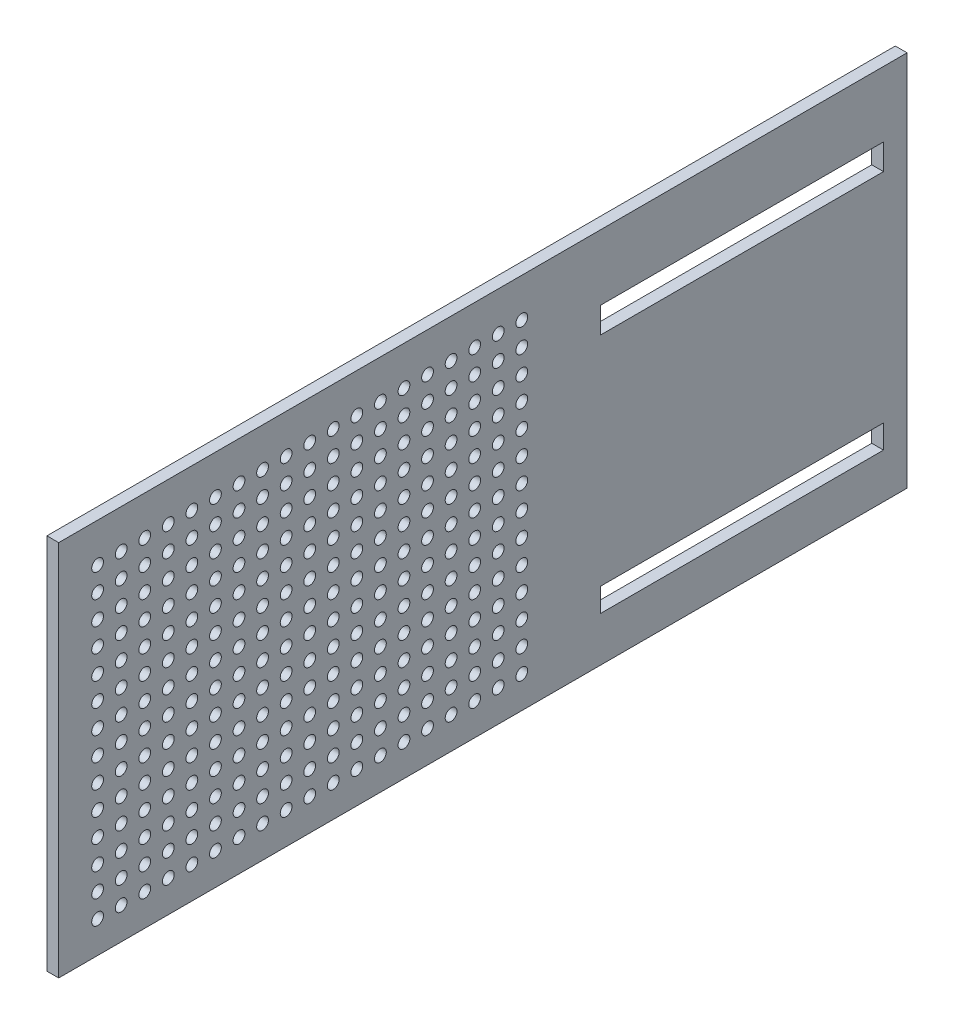
from build123d import *

# Parameters (mm, degrees)
BOSS_EXTRUDE1_DEPTH = 228.6
CUT_EXTRUDE1_REACH  = 239.256
SKETCH3_W           = 76.2
SKETCH3_H           = 6.35
SKETCH3_H_2         = 6.941694096
SKETCH4_R           = 1.5875
CUT_EXTRUDE2_DEPTH  = 3.175
CUT_EXTRUDE3_REACH  = 254.812
SKETCH5_W           = 6.604
SKETCH5_H           = 152.4
SKETCH6_R           = 1.5875
CUT_EXTRUDE4_DEPTH  = 3.175
SKETCH7_W           = 34.925
SKETCH7_H           = 3.175
CUT_EXTRUDE5_DEPTH  = 238.005828317


with BuildPart() as part:
    # Sketch1 → Boss-Extrude1 (new body)
    with BuildSketch(Plane.XY):
        Polygon((1.5875, 47.625), (36.5125, 47.625), (36.5125, 50.8), (-1.5875, 50.8), (-1.5875, -50.8), (1.5875, -50.8), align=None)
    extrude(amount=BOSS_EXTRUDE1_DEPTH)

    # Sketch3 → Cut-Extrude1 (cut, up to next)
    with BuildSketch(Plane.ZY.offset(1.5875), mode=Mode.PRIVATE) as cut_extrude1_sk1:
        with Locations((44.45, -35.56)):
            Rectangle(SKETCH3_W, SKETCH3_H)
    cut_extrude1_tool1 = extrude(cut_extrude1_sk1.sketch, amount=-CUT_EXTRUDE1_REACH, mode=Mode.PRIVATE) & part.part
    # Sketch3 → Cut-Extrude1 (cut, up to next)
    with BuildSketch(Plane.ZY.offset(1.5875), mode=Mode.PRIVATE) as cut_extrude1_sk2:
        with Locations((44.45, 29.718)):
            Rectangle(SKETCH3_W, SKETCH3_H_2)
    cut_extrude1_tool2 = extrude(cut_extrude1_sk2.sketch, amount=-CUT_EXTRUDE1_REACH, mode=Mode.PRIVATE) & part.part
    add(cut_extrude1_tool1.solids().sort_by_distance((-1.5875, -35.56, 44.45))[0], mode=Mode.SUBTRACT)
    add(cut_extrude1_tool2.solids().sort_by_distance((-1.5875, 29.718, 44.45))[0], mode=Mode.SUBTRACT)

    # Sketch4 → Cut-Extrude2 (cut)
    with BuildSketch(Plane.ZY.offset(1.5875)):
        with Locations(Location((103.818466909, 40.328941299, 0), (0, 0, 270))):
            Circle(SKETCH4_R)
        with Locations(Location((110.168466909, 40.328941299, 0), (0, 0, 270))):
            Circle(SKETCH4_R)
        with Locations(Location((116.518466909, 40.328941299, 0), (0, 0, 270))):
            Circle(SKETCH4_R)
        with Locations(Location((122.868466909, 40.328941299, 0), (0, 0, 270))):
            Circle(SKETCH4_R)
        with Locations(Location((129.218466909, 40.328941299, 0), (0, 0, 270))):
            Circle(SKETCH4_R)
        with Locations(Location((110.168466909, 33.978941299, 0), (0, 0, 270))):
            Circle(SKETCH4_R)
        with Locations(Location((116.518466909, 33.978941299, 0), (0, 0, 270))):
            Circle(SKETCH4_R)
        with Locations(Location((122.868466909, 33.978941299, 0), (0, 0, 270))):
            Circle(SKETCH4_R)
        with Locations(Location((129.218466909, 33.978941299, 0), (0, 0, 270))):
            Circle(SKETCH4_R)
        with Locations(Location((110.168466909, 27.628941299, 0), (0, 0, 270))):
            Circle(SKETCH4_R)
        with Locations(Location((116.518466909, 27.628941299, 0), (0, 0, 270))):
            Circle(SKETCH4_R)
        with Locations(Location((122.868466909, 27.628941299, 0), (0, 0, 270))):
            Circle(SKETCH4_R)
        with Locations(Location((129.218466909, 27.628941299, 0), (0, 0, 270))):
            Circle(SKETCH4_R)
        with Locations(Location((110.168466909, 21.278941299, 0), (0, 0, 270))):
            Circle(SKETCH4_R)
        with Locations(Location((116.518466909, 21.278941299, 0), (0, 0, 270))):
            Circle(SKETCH4_R)
        with Locations(Location((122.868466909, 21.278941299, 0), (0, 0, 270))):
            Circle(SKETCH4_R)
        with Locations(Location((129.218466909, 21.278941299, 0), (0, 0, 270))):
            Circle(SKETCH4_R)
        with Locations(Location((103.818466909, 33.978941299, 0), (0, 0, 270))):
            Circle(SKETCH4_R)
        with Locations(Location((103.818466909, 27.628941299, 0), (0, 0, 270))):
            Circle(SKETCH4_R)
        with Locations(Location((103.818466909, 21.278941299, 0), (0, 0, 270))):
            Circle(SKETCH4_R)
        with Locations(Location((135.568466909, 40.328941299, 0), (0, 0, 270))):
            Circle(SKETCH4_R)
        with Locations(Location((141.918466909, 40.328941299, 0), (0, 0, 270))):
            Circle(SKETCH4_R)
        with Locations(Location((148.268466909, 40.328941299, 0), (0, 0, 270))):
            Circle(SKETCH4_R)
        with Locations(Location((154.618466909, 40.328941299, 0), (0, 0, 270))):
            Circle(SKETCH4_R)
        with Locations(Location((160.968466909, 40.328941299, 0), (0, 0, 270))):
            Circle(SKETCH4_R)
        with Locations(Location((167.318466909, 40.328941299, 0), (0, 0, 270))):
            Circle(SKETCH4_R)
        with Locations(Location((173.668466909, 40.328941299, 0), (0, 0, 270))):
            Circle(SKETCH4_R)
        with Locations(Location((180.018466909, 40.328941299, 0), (0, 0, 270))):
            Circle(SKETCH4_R)
        with Locations(Location((186.368466909, 40.328941299, 0), (0, 0, 270))):
            Circle(SKETCH4_R)
        with Locations(Location((192.718466909, 40.328941299, 0), (0, 0, 270))):
            Circle(SKETCH4_R)
        with Locations(Location((199.068466909, 40.328941299, 0), (0, 0, 270))):
            Circle(SKETCH4_R)
        with Locations(Location((205.418466909, 40.328941299, 0), (0, 0, 270))):
            Circle(SKETCH4_R)
        with Locations(Location((211.768466909, 40.328941299, 0), (0, 0, 270))):
            Circle(SKETCH4_R)
        with Locations(Location((218.118466909, 40.328941299, 0), (0, 0, 270))):
            Circle(SKETCH4_R)
        with Locations(Location((135.568466909, 33.978941299, 0), (0, 0, 270))):
            Circle(SKETCH4_R)
        with Locations(Location((141.918466909, 33.978941299, 0), (0, 0, 270))):
            Circle(SKETCH4_R)
        with Locations(Location((148.268466909, 33.978941299, 0), (0, 0, 270))):
            Circle(SKETCH4_R)
        with Locations(Location((154.618466909, 33.978941299, 0), (0, 0, 270))):
            Circle(SKETCH4_R)
        with Locations(Location((160.968466909, 33.978941299, 0), (0, 0, 270))):
            Circle(SKETCH4_R)
        with Locations(Location((167.318466909, 33.978941299, 0), (0, 0, 270))):
            Circle(SKETCH4_R)
        with Locations(Location((173.668466909, 33.978941299, 0), (0, 0, 270))):
            Circle(SKETCH4_R)
        with Locations(Location((180.018466909, 33.978941299, 0), (0, 0, 270))):
            Circle(SKETCH4_R)
        with Locations(Location((186.368466909, 33.978941299, 0), (0, 0, 270))):
            Circle(SKETCH4_R)
        with Locations(Location((192.718466909, 33.978941299, 0), (0, 0, 270))):
            Circle(SKETCH4_R)
        with Locations(Location((199.068466909, 33.978941299, 0), (0, 0, 270))):
            Circle(SKETCH4_R)
        with Locations(Location((205.418466909, 33.978941299, 0), (0, 0, 270))):
            Circle(SKETCH4_R)
        with Locations(Location((211.768466909, 33.978941299, 0), (0, 0, 270))):
            Circle(SKETCH4_R)
        with Locations(Location((218.118466909, 33.978941299, 0), (0, 0, 270))):
            Circle(SKETCH4_R)
        with Locations(Location((135.568466909, 27.628941299, 0), (0, 0, 270))):
            Circle(SKETCH4_R)
        with Locations(Location((141.918466909, 27.628941299, 0), (0, 0, 270))):
            Circle(SKETCH4_R)
        with Locations(Location((148.268466909, 27.628941299, 0), (0, 0, 270))):
            Circle(SKETCH4_R)
        with Locations(Location((154.618466909, 27.628941299, 0), (0, 0, 270))):
            Circle(SKETCH4_R)
        with Locations(Location((160.968466909, 27.628941299, 0), (0, 0, 270))):
            Circle(SKETCH4_R)
        with Locations(Location((167.318466909, 27.628941299, 0), (0, 0, 270))):
            Circle(SKETCH4_R)
        with Locations(Location((173.668466909, 27.628941299, 0), (0, 0, 270))):
            Circle(SKETCH4_R)
        with Locations(Location((180.018466909, 27.628941299, 0), (0, 0, 270))):
            Circle(SKETCH4_R)
        with Locations(Location((186.368466909, 27.628941299, 0), (0, 0, 270))):
            Circle(SKETCH4_R)
        with Locations(Location((192.718466909, 27.628941299, 0), (0, 0, 270))):
            Circle(SKETCH4_R)
        with Locations(Location((199.068466909, 27.628941299, 0), (0, 0, 270))):
            Circle(SKETCH4_R)
        with Locations(Location((205.418466909, 27.628941299, 0), (0, 0, 270))):
            Circle(SKETCH4_R)
        with Locations(Location((211.768466909, 27.628941299, 0), (0, 0, 270))):
            Circle(SKETCH4_R)
        with Locations(Location((218.118466909, 27.628941299, 0), (0, 0, 270))):
            Circle(SKETCH4_R)
        with Locations(Location((135.568466909, 21.278941299, 0), (0, 0, 270))):
            Circle(SKETCH4_R)
        with Locations(Location((141.918466909, 21.278941299, 0), (0, 0, 270))):
            Circle(SKETCH4_R)
        with Locations(Location((148.268466909, 21.278941299, 0), (0, 0, 270))):
            Circle(SKETCH4_R)
        with Locations(Location((154.618466909, 21.278941299, 0), (0, 0, 270))):
            Circle(SKETCH4_R)
        with Locations(Location((160.968466909, 21.278941299, 0), (0, 0, 270))):
            Circle(SKETCH4_R)
        with Locations(Location((167.318466909, 21.278941299, 0), (0, 0, 270))):
            Circle(SKETCH4_R)
        with Locations(Location((173.668466909, 21.278941299, 0), (0, 0, 270))):
            Circle(SKETCH4_R)
        with Locations(Location((180.018466909, 21.278941299, 0), (0, 0, 270))):
            Circle(SKETCH4_R)
        with Locations(Location((186.368466909, 21.278941299, 0), (0, 0, 270))):
            Circle(SKETCH4_R)
        with Locations(Location((192.718466909, 21.278941299, 0), (0, 0, 270))):
            Circle(SKETCH4_R)
        with Locations(Location((199.068466909, 21.278941299, 0), (0, 0, 270))):
            Circle(SKETCH4_R)
        with Locations(Location((205.418466909, 21.278941299, 0), (0, 0, 270))):
            Circle(SKETCH4_R)
        with Locations(Location((211.768466909, 21.278941299, 0), (0, 0, 270))):
            Circle(SKETCH4_R)
        with Locations(Location((218.118466909, 21.278941299, 0), (0, 0, 270))):
            Circle(SKETCH4_R)
        with Locations(Location((103.818466909, 14.928941299, 0), (0, 0, 270))):
            Circle(SKETCH4_R)
        with Locations(Location((110.168466909, 14.928941299, 0), (0, 0, 270))):
            Circle(SKETCH4_R)
        with Locations(Location((116.518466909, 14.928941299, 0), (0, 0, 270))):
            Circle(SKETCH4_R)
        with Locations(Location((122.868466909, 14.928941299, 0), (0, 0, 270))):
            Circle(SKETCH4_R)
        with Locations(Location((129.218466909, 14.928941299, 0), (0, 0, 270))):
            Circle(SKETCH4_R)
        with Locations(Location((135.568466909, 14.928941299, 0), (0, 0, 270))):
            Circle(SKETCH4_R)
        with Locations(Location((141.918466909, 14.928941299, 0), (0, 0, 270))):
            Circle(SKETCH4_R)
        with Locations(Location((148.268466909, 14.928941299, 0), (0, 0, 270))):
            Circle(SKETCH4_R)
        with Locations(Location((154.618466909, 14.928941299, 0), (0, 0, 270))):
            Circle(SKETCH4_R)
        with Locations(Location((160.968466909, 14.928941299, 0), (0, 0, 270))):
            Circle(SKETCH4_R)
        with Locations(Location((167.318466909, 14.928941299, 0), (0, 0, 270))):
            Circle(SKETCH4_R)
        with Locations(Location((173.668466909, 14.928941299, 0), (0, 0, 270))):
            Circle(SKETCH4_R)
        with Locations(Location((180.018466909, 14.928941299, 0), (0, 0, 270))):
            Circle(SKETCH4_R)
        with Locations(Location((186.368466909, 14.928941299, 0), (0, 0, 270))):
            Circle(SKETCH4_R)
        with Locations(Location((192.718466909, 14.928941299, 0), (0, 0, 270))):
            Circle(SKETCH4_R)
        with Locations(Location((199.068466909, 14.928941299, 0), (0, 0, 270))):
            Circle(SKETCH4_R)
        with Locations(Location((205.418466909, 14.928941299, 0), (0, 0, 270))):
            Circle(SKETCH4_R)
        with Locations(Location((211.768466909, 14.928941299, 0), (0, 0, 270))):
            Circle(SKETCH4_R)
        with Locations(Location((218.118466909, 14.928941299, 0), (0, 0, 270))):
            Circle(SKETCH4_R)
        with Locations(Location((103.818466909, 8.578941299, 0), (0, 0, 270))):
            Circle(SKETCH4_R)
        with Locations(Location((110.168466909, 8.578941299, 0), (0, 0, 270))):
            Circle(SKETCH4_R)
        with Locations(Location((116.518466909, 8.578941299, 0), (0, 0, 270))):
            Circle(SKETCH4_R)
        with Locations(Location((122.868466909, 8.578941299, 0), (0, 0, 270))):
            Circle(SKETCH4_R)
        with Locations(Location((129.218466909, 8.578941299, 0), (0, 0, 270))):
            Circle(SKETCH4_R)
        with Locations(Location((135.568466909, 8.578941299, 0), (0, 0, 270))):
            Circle(SKETCH4_R)
        with Locations(Location((141.918466909, 8.578941299, 0), (0, 0, 270))):
            Circle(SKETCH4_R)
        with Locations(Location((148.268466909, 8.578941299, 0), (0, 0, 270))):
            Circle(SKETCH4_R)
        with Locations(Location((154.618466909, 8.578941299, 0), (0, 0, 270))):
            Circle(SKETCH4_R)
        with Locations(Location((160.968466909, 8.578941299, 0), (0, 0, 270))):
            Circle(SKETCH4_R)
        with Locations(Location((167.318466909, 8.578941299, 0), (0, 0, 270))):
            Circle(SKETCH4_R)
        with Locations(Location((173.668466909, 8.578941299, 0), (0, 0, 270))):
            Circle(SKETCH4_R)
        with Locations(Location((180.018466909, 8.578941299, 0), (0, 0, 270))):
            Circle(SKETCH4_R)
        with Locations(Location((186.368466909, 8.578941299, 0), (0, 0, 270))):
            Circle(SKETCH4_R)
        with Locations(Location((192.718466909, 8.578941299, 0), (0, 0, 270))):
            Circle(SKETCH4_R)
        with Locations(Location((199.068466909, 8.578941299, 0), (0, 0, 270))):
            Circle(SKETCH4_R)
        with Locations(Location((205.418466909, 8.578941299, 0), (0, 0, 270))):
            Circle(SKETCH4_R)
        with Locations(Location((211.768466909, 8.578941299, 0), (0, 0, 270))):
            Circle(SKETCH4_R)
        with Locations(Location((218.118466909, 8.578941299, 0), (0, 0, 270))):
            Circle(SKETCH4_R)
        with Locations(Location((103.818466909, 2.228941299, 0), (0, 0, 270))):
            Circle(SKETCH4_R)
        with Locations(Location((110.168466909, 2.228941299, 0), (0, 0, 270))):
            Circle(SKETCH4_R)
        with Locations(Location((116.518466909, 2.228941299, 0), (0, 0, 270))):
            Circle(SKETCH4_R)
        with Locations(Location((122.868466909, 2.228941299, 0), (0, 0, 270))):
            Circle(SKETCH4_R)
        with Locations(Location((129.218466909, 2.228941299, 0), (0, 0, 270))):
            Circle(SKETCH4_R)
        with Locations(Location((135.568466909, 2.228941299, 0), (0, 0, 270))):
            Circle(SKETCH4_R)
        with Locations(Location((141.918466909, 2.228941299, 0), (0, 0, 270))):
            Circle(SKETCH4_R)
        with Locations(Location((148.268466909, 2.228941299, 0), (0, 0, 270))):
            Circle(SKETCH4_R)
        with Locations(Location((154.618466909, 2.228941299, 0), (0, 0, 270))):
            Circle(SKETCH4_R)
        with Locations(Location((160.968466909, 2.228941299, 0), (0, 0, 270))):
            Circle(SKETCH4_R)
        with Locations(Location((167.318466909, 2.228941299, 0), (0, 0, 270))):
            Circle(SKETCH4_R)
        with Locations(Location((173.668466909, 2.228941299, 0), (0, 0, 270))):
            Circle(SKETCH4_R)
        with Locations(Location((180.018466909, 2.228941299, 0), (0, 0, 270))):
            Circle(SKETCH4_R)
        with Locations(Location((186.368466909, 2.228941299, 0), (0, 0, 270))):
            Circle(SKETCH4_R)
        with Locations(Location((192.718466909, 2.228941299, 0), (0, 0, 270))):
            Circle(SKETCH4_R)
        with Locations(Location((199.068466909, 2.228941299, 0), (0, 0, 270))):
            Circle(SKETCH4_R)
        with Locations(Location((205.418466909, 2.228941299, 0), (0, 0, 270))):
            Circle(SKETCH4_R)
        with Locations(Location((211.768466909, 2.228941299, 0), (0, 0, 270))):
            Circle(SKETCH4_R)
        with Locations(Location((218.118466909, 2.228941299, 0), (0, 0, 270))):
            Circle(SKETCH4_R)
        with Locations(Location((103.818466909, -4.121058701, 0), (0, 0, 270))):
            Circle(SKETCH4_R)
        with Locations(Location((110.168466909, -4.121058701, 0), (0, 0, 270))):
            Circle(SKETCH4_R)
        with Locations(Location((116.518466909, -4.121058701, 0), (0, 0, 270))):
            Circle(SKETCH4_R)
        with Locations(Location((122.868466909, -4.121058701, 0), (0, 0, 270))):
            Circle(SKETCH4_R)
        with Locations(Location((129.218466909, -4.121058701, 0), (0, 0, 270))):
            Circle(SKETCH4_R)
        with Locations(Location((135.568466909, -4.121058701, 0), (0, 0, 270))):
            Circle(SKETCH4_R)
        with Locations(Location((141.918466909, -4.121058701, 0), (0, 0, 270))):
            Circle(SKETCH4_R)
        with Locations(Location((148.268466909, -4.121058701, 0), (0, 0, 270))):
            Circle(SKETCH4_R)
        with Locations(Location((154.618466909, -4.121058701, 0), (0, 0, 270))):
            Circle(SKETCH4_R)
        with Locations(Location((160.968466909, -4.121058701, 0), (0, 0, 270))):
            Circle(SKETCH4_R)
        with Locations(Location((167.318466909, -4.121058701, 0), (0, 0, 270))):
            Circle(SKETCH4_R)
        with Locations(Location((173.668466909, -4.121058701, 0), (0, 0, 270))):
            Circle(SKETCH4_R)
        with Locations(Location((180.018466909, -4.121058701, 0), (0, 0, 270))):
            Circle(SKETCH4_R)
        with Locations(Location((186.368466909, -4.121058701, 0), (0, 0, 270))):
            Circle(SKETCH4_R)
        with Locations(Location((192.718466909, -4.121058701, 0), (0, 0, 270))):
            Circle(SKETCH4_R)
        with Locations(Location((199.068466909, -4.121058701, 0), (0, 0, 270))):
            Circle(SKETCH4_R)
        with Locations(Location((205.418466909, -4.121058701, 0), (0, 0, 270))):
            Circle(SKETCH4_R)
        with Locations(Location((211.768466909, -4.121058701, 0), (0, 0, 270))):
            Circle(SKETCH4_R)
        with Locations(Location((218.118466909, -4.121058701, 0), (0, 0, 270))):
            Circle(SKETCH4_R)
        with Locations(Location((103.818466909, -10.471058701, 0), (0, 0, 270))):
            Circle(SKETCH4_R)
        with Locations(Location((110.168466909, -10.471058701, 0), (0, 0, 270))):
            Circle(SKETCH4_R)
        with Locations(Location((116.518466909, -10.471058701, 0), (0, 0, 270))):
            Circle(SKETCH4_R)
        with Locations(Location((122.868466909, -10.471058701, 0), (0, 0, 270))):
            Circle(SKETCH4_R)
        with Locations(Location((129.218466909, -10.471058701, 0), (0, 0, 270))):
            Circle(SKETCH4_R)
        with Locations(Location((135.568466909, -10.471058701, 0), (0, 0, 270))):
            Circle(SKETCH4_R)
        with Locations(Location((141.918466909, -10.471058701, 0), (0, 0, 270))):
            Circle(SKETCH4_R)
        with Locations(Location((148.268466909, -10.471058701, 0), (0, 0, 270))):
            Circle(SKETCH4_R)
        with Locations(Location((154.618466909, -10.471058701, 0), (0, 0, 270))):
            Circle(SKETCH4_R)
        with Locations(Location((160.968466909, -10.471058701, 0), (0, 0, 270))):
            Circle(SKETCH4_R)
        with Locations(Location((167.318466909, -10.471058701, 0), (0, 0, 270))):
            Circle(SKETCH4_R)
        with Locations(Location((173.668466909, -10.471058701, 0), (0, 0, 270))):
            Circle(SKETCH4_R)
        with Locations(Location((180.018466909, -10.471058701, 0), (0, 0, 270))):
            Circle(SKETCH4_R)
        with Locations(Location((186.368466909, -10.471058701, 0), (0, 0, 270))):
            Circle(SKETCH4_R)
        with Locations(Location((192.718466909, -10.471058701, 0), (0, 0, 270))):
            Circle(SKETCH4_R)
        with Locations(Location((199.068466909, -10.471058701, 0), (0, 0, 270))):
            Circle(SKETCH4_R)
        with Locations(Location((205.418466909, -10.471058701, 0), (0, 0, 270))):
            Circle(SKETCH4_R)
        with Locations(Location((211.768466909, -10.471058701, 0), (0, 0, 270))):
            Circle(SKETCH4_R)
        with Locations(Location((218.118466909, -10.471058701, 0), (0, 0, 270))):
            Circle(SKETCH4_R)
        with Locations(Location((103.818466909, -16.821058701, 0), (0, 0, 270))):
            Circle(SKETCH4_R)
        with Locations(Location((110.168466909, -16.821058701, 0), (0, 0, 270))):
            Circle(SKETCH4_R)
        with Locations(Location((116.518466909, -16.821058701, 0), (0, 0, 270))):
            Circle(SKETCH4_R)
        with Locations(Location((122.868466909, -16.821058701, 0), (0, 0, 270))):
            Circle(SKETCH4_R)
        with Locations(Location((129.218466909, -16.821058701, 0), (0, 0, 270))):
            Circle(SKETCH4_R)
        with Locations(Location((135.568466909, -16.821058701, 0), (0, 0, 270))):
            Circle(SKETCH4_R)
        with Locations(Location((141.918466909, -16.821058701, 0), (0, 0, 270))):
            Circle(SKETCH4_R)
        with Locations(Location((148.268466909, -16.821058701, 0), (0, 0, 270))):
            Circle(SKETCH4_R)
        with Locations(Location((154.618466909, -16.821058701, 0), (0, 0, 270))):
            Circle(SKETCH4_R)
        with Locations(Location((160.968466909, -16.821058701, 0), (0, 0, 270))):
            Circle(SKETCH4_R)
        with Locations(Location((167.318466909, -16.821058701, 0), (0, 0, 270))):
            Circle(SKETCH4_R)
        with Locations(Location((173.668466909, -16.821058701, 0), (0, 0, 270))):
            Circle(SKETCH4_R)
        with Locations(Location((180.018466909, -16.821058701, 0), (0, 0, 270))):
            Circle(SKETCH4_R)
        with Locations(Location((186.368466909, -16.821058701, 0), (0, 0, 270))):
            Circle(SKETCH4_R)
        with Locations(Location((192.718466909, -16.821058701, 0), (0, 0, 270))):
            Circle(SKETCH4_R)
        with Locations(Location((199.068466909, -16.821058701, 0), (0, 0, 270))):
            Circle(SKETCH4_R)
        with Locations(Location((205.418466909, -16.821058701, 0), (0, 0, 270))):
            Circle(SKETCH4_R)
        with Locations(Location((211.768466909, -16.821058701, 0), (0, 0, 270))):
            Circle(SKETCH4_R)
        with Locations(Location((218.118466909, -16.821058701, 0), (0, 0, 270))):
            Circle(SKETCH4_R)
        with Locations(Location((103.818466909, -23.171058701, 0), (0, 0, 270))):
            Circle(SKETCH4_R)
        with Locations(Location((110.168466909, -23.171058701, 0), (0, 0, 270))):
            Circle(SKETCH4_R)
        with Locations(Location((116.518466909, -23.171058701, 0), (0, 0, 270))):
            Circle(SKETCH4_R)
        with Locations(Location((122.868466909, -23.171058701, 0), (0, 0, 270))):
            Circle(SKETCH4_R)
        with Locations(Location((129.218466909, -23.171058701, 0), (0, 0, 270))):
            Circle(SKETCH4_R)
        with Locations(Location((135.568466909, -23.171058701, 0), (0, 0, 270))):
            Circle(SKETCH4_R)
        with Locations(Location((141.918466909, -23.171058701, 0), (0, 0, 270))):
            Circle(SKETCH4_R)
        with Locations(Location((148.268466909, -23.171058701, 0), (0, 0, 270))):
            Circle(SKETCH4_R)
        with Locations(Location((154.618466909, -23.171058701, 0), (0, 0, 270))):
            Circle(SKETCH4_R)
        with Locations(Location((160.968466909, -23.171058701, 0), (0, 0, 270))):
            Circle(SKETCH4_R)
        with Locations(Location((167.318466909, -23.171058701, 0), (0, 0, 270))):
            Circle(SKETCH4_R)
        with Locations(Location((173.668466909, -23.171058701, 0), (0, 0, 270))):
            Circle(SKETCH4_R)
        with Locations(Location((180.018466909, -23.171058701, 0), (0, 0, 270))):
            Circle(SKETCH4_R)
        with Locations(Location((186.368466909, -23.171058701, 0), (0, 0, 270))):
            Circle(SKETCH4_R)
        with Locations(Location((192.718466909, -23.171058701, 0), (0, 0, 270))):
            Circle(SKETCH4_R)
        with Locations(Location((199.068466909, -23.171058701, 0), (0, 0, 270))):
            Circle(SKETCH4_R)
        with Locations(Location((205.418466909, -23.171058701, 0), (0, 0, 270))):
            Circle(SKETCH4_R)
        with Locations(Location((211.768466909, -23.171058701, 0), (0, 0, 270))):
            Circle(SKETCH4_R)
        with Locations(Location((218.118466909, -23.171058701, 0), (0, 0, 270))):
            Circle(SKETCH4_R)
        with Locations(Location((103.818466909, -29.521058701, 0), (0, 0, 270))):
            Circle(SKETCH4_R)
        with Locations(Location((110.168466909, -29.521058701, 0), (0, 0, 270))):
            Circle(SKETCH4_R)
        with Locations(Location((116.518466909, -29.521058701, 0), (0, 0, 270))):
            Circle(SKETCH4_R)
        with Locations(Location((122.868466909, -29.521058701, 0), (0, 0, 270))):
            Circle(SKETCH4_R)
        with Locations(Location((129.218466909, -29.521058701, 0), (0, 0, 270))):
            Circle(SKETCH4_R)
        with Locations(Location((135.568466909, -29.521058701, 0), (0, 0, 270))):
            Circle(SKETCH4_R)
        with Locations(Location((141.918466909, -29.521058701, 0), (0, 0, 270))):
            Circle(SKETCH4_R)
        with Locations(Location((148.268466909, -29.521058701, 0), (0, 0, 270))):
            Circle(SKETCH4_R)
        with Locations(Location((154.618466909, -29.521058701, 0), (0, 0, 270))):
            Circle(SKETCH4_R)
        with Locations(Location((160.968466909, -29.521058701, 0), (0, 0, 270))):
            Circle(SKETCH4_R)
        with Locations(Location((167.318466909, -29.521058701, 0), (0, 0, 270))):
            Circle(SKETCH4_R)
        with Locations(Location((173.668466909, -29.521058701, 0), (0, 0, 270))):
            Circle(SKETCH4_R)
        with Locations(Location((180.018466909, -29.521058701, 0), (0, 0, 270))):
            Circle(SKETCH4_R)
        with Locations(Location((186.368466909, -29.521058701, 0), (0, 0, 270))):
            Circle(SKETCH4_R)
        with Locations(Location((192.718466909, -29.521058701, 0), (0, 0, 270))):
            Circle(SKETCH4_R)
        with Locations(Location((199.068466909, -29.521058701, 0), (0, 0, 270))):
            Circle(SKETCH4_R)
        with Locations(Location((205.418466909, -29.521058701, 0), (0, 0, 270))):
            Circle(SKETCH4_R)
        with Locations(Location((211.768466909, -29.521058701, 0), (0, 0, 270))):
            Circle(SKETCH4_R)
        with Locations(Location((218.118466909, -29.521058701, 0), (0, 0, 270))):
            Circle(SKETCH4_R)
        with Locations(Location((103.818466909, -35.871058701, 0), (0, 0, 270))):
            Circle(SKETCH4_R)
        with Locations(Location((110.168466909, -35.871058701, 0), (0, 0, 270))):
            Circle(SKETCH4_R)
        with Locations(Location((116.518466909, -35.871058701, 0), (0, 0, 270))):
            Circle(SKETCH4_R)
        with Locations(Location((122.868466909, -35.871058701, 0), (0, 0, 270))):
            Circle(SKETCH4_R)
        with Locations(Location((129.218466909, -35.871058701, 0), (0, 0, 270))):
            Circle(SKETCH4_R)
        with Locations(Location((135.568466909, -35.871058701, 0), (0, 0, 270))):
            Circle(SKETCH4_R)
        with Locations(Location((141.918466909, -35.871058701, 0), (0, 0, 270))):
            Circle(SKETCH4_R)
        with Locations(Location((148.268466909, -35.871058701, 0), (0, 0, 270))):
            Circle(SKETCH4_R)
        with Locations(Location((154.618466909, -35.871058701, 0), (0, 0, 270))):
            Circle(SKETCH4_R)
        with Locations(Location((160.968466909, -35.871058701, 0), (0, 0, 270))):
            Circle(SKETCH4_R)
        with Locations(Location((167.318466909, -35.871058701, 0), (0, 0, 270))):
            Circle(SKETCH4_R)
        with Locations(Location((173.668466909, -35.871058701, 0), (0, 0, 270))):
            Circle(SKETCH4_R)
        with Locations(Location((180.018466909, -35.871058701, 0), (0, 0, 270))):
            Circle(SKETCH4_R)
        with Locations(Location((186.368466909, -35.871058701, 0), (0, 0, 270))):
            Circle(SKETCH4_R)
        with Locations(Location((192.718466909, -35.871058701, 0), (0, 0, 270))):
            Circle(SKETCH4_R)
        with Locations(Location((199.068466909, -35.871058701, 0), (0, 0, 270))):
            Circle(SKETCH4_R)
        with Locations(Location((205.418466909, -35.871058701, 0), (0, 0, 270))):
            Circle(SKETCH4_R)
        with Locations(Location((211.768466909, -35.871058701, 0), (0, 0, 270))):
            Circle(SKETCH4_R)
        with Locations(Location((218.118466909, -35.871058701, 0), (0, 0, 270))):
            Circle(SKETCH4_R)
        with Locations(Location((103.818466909, -42.221058701, 0), (0, 0, 270))):
            Circle(SKETCH4_R)
        with Locations(Location((110.168466909, -42.221058701, 0), (0, 0, 270))):
            Circle(SKETCH4_R)
        with Locations(Location((116.518466909, -42.221058701, 0), (0, 0, 270))):
            Circle(SKETCH4_R)
        with Locations(Location((122.868466909, -42.221058701, 0), (0, 0, 270))):
            Circle(SKETCH4_R)
        with Locations(Location((129.218466909, -42.221058701, 0), (0, 0, 270))):
            Circle(SKETCH4_R)
        with Locations(Location((135.568466909, -42.221058701, 0), (0, 0, 270))):
            Circle(SKETCH4_R)
        with Locations(Location((141.918466909, -42.221058701, 0), (0, 0, 270))):
            Circle(SKETCH4_R)
        with Locations(Location((148.268466909, -42.221058701, 0), (0, 0, 270))):
            Circle(SKETCH4_R)
        with Locations(Location((154.618466909, -42.221058701, 0), (0, 0, 270))):
            Circle(SKETCH4_R)
        with Locations(Location((160.968466909, -42.221058701, 0), (0, 0, 270))):
            Circle(SKETCH4_R)
        with Locations(Location((167.318466909, -42.221058701, 0), (0, 0, 270))):
            Circle(SKETCH4_R)
        with Locations(Location((173.668466909, -42.221058701, 0), (0, 0, 270))):
            Circle(SKETCH4_R)
        with Locations(Location((180.018466909, -42.221058701, 0), (0, 0, 270))):
            Circle(SKETCH4_R)
        with Locations(Location((186.368466909, -42.221058701, 0), (0, 0, 270))):
            Circle(SKETCH4_R)
        with Locations(Location((192.718466909, -42.221058701, 0), (0, 0, 270))):
            Circle(SKETCH4_R)
        with Locations(Location((199.068466909, -42.221058701, 0), (0, 0, 270))):
            Circle(SKETCH4_R)
        with Locations(Location((205.418466909, -42.221058701, 0), (0, 0, 270))):
            Circle(SKETCH4_R)
        with Locations(Location((211.768466909, -42.221058701, 0), (0, 0, 270))):
            Circle(SKETCH4_R)
        with Locations(Location((218.118466909, -42.221058701, 0), (0, 0, 270))):
            Circle(SKETCH4_R)
    extrude(amount=-CUT_EXTRUDE2_DEPTH, mode=Mode.SUBTRACT)

    # Sketch5 → Cut-Extrude3 (cut, up to next)
    with BuildSketch(Plane(origin=(0, 50.8, 0), x_dir=(1, 0, 0), z_dir=(0, 1, 0)), mode=Mode.PRIVATE) as cut_extrude3_sk1:
        with Locations((15.4305, -81.28)):
            Rectangle(SKETCH5_W, SKETCH5_H)
    cut_extrude3_tool1 = extrude(cut_extrude3_sk1.sketch, amount=-CUT_EXTRUDE3_REACH, mode=Mode.PRIVATE) & part.part
    add(cut_extrude3_tool1.solids().sort_by_distance((15.4305, 50.8, 81.28))[0], mode=Mode.SUBTRACT)

    # Sketch6 → Cut-Extrude4 (cut)
    with BuildSketch(Plane(origin=(0, 50.8, 0), x_dir=(1, 0, 0), z_dir=(0, 1, 0))):
        with Locations(Location((6.0325, -222.25, 0), (0, 0, 180))):
            Circle(SKETCH6_R)
        with Locations(Location((12.3825, -222.25, 0), (0, 0, 180))):
            Circle(SKETCH6_R)
        with Locations(Location((18.7325, -222.25, 0), (0, 0, 180))):
            Circle(SKETCH6_R)
        with Locations(Location((25.0825, -222.25, 0), (0, 0, 180))):
            Circle(SKETCH6_R)
        with Locations(Location((31.4325, -222.25, 0), (0, 0, 180))):
            Circle(SKETCH6_R)
        with Locations(Location((12.3825, -215.9, 0), (0, 0, 180))):
            Circle(SKETCH6_R)
        with Locations(Location((18.7325, -215.9, 0), (0, 0, 180))):
            Circle(SKETCH6_R)
        with Locations(Location((25.0825, -215.9, 0), (0, 0, 180))):
            Circle(SKETCH6_R)
        with Locations(Location((31.4325, -215.9, 0), (0, 0, 180))):
            Circle(SKETCH6_R)
        with Locations(Location((12.3825, -209.55, 0), (0, 0, 180))):
            Circle(SKETCH6_R)
        with Locations(Location((18.7325, -209.55, 0), (0, 0, 180))):
            Circle(SKETCH6_R)
        with Locations(Location((25.0825, -209.55, 0), (0, 0, 180))):
            Circle(SKETCH6_R)
        with Locations(Location((31.4325, -209.55, 0), (0, 0, 180))):
            Circle(SKETCH6_R)
        with Locations(Location((12.3825, -203.2, 0), (0, 0, 180))):
            Circle(SKETCH6_R)
        with Locations(Location((18.7325, -203.2, 0), (0, 0, 180))):
            Circle(SKETCH6_R)
        with Locations(Location((25.0825, -203.2, 0), (0, 0, 180))):
            Circle(SKETCH6_R)
        with Locations(Location((31.4325, -203.2, 0), (0, 0, 180))):
            Circle(SKETCH6_R)
        with Locations(Location((12.3825, -196.85, 0), (0, 0, 180))):
            Circle(SKETCH6_R)
        with Locations(Location((18.7325, -196.85, 0), (0, 0, 180))):
            Circle(SKETCH6_R)
        with Locations(Location((25.0825, -196.85, 0), (0, 0, 180))):
            Circle(SKETCH6_R)
        with Locations(Location((31.4325, -196.85, 0), (0, 0, 180))):
            Circle(SKETCH6_R)
        with Locations(Location((12.3825, -190.5, 0), (0, 0, 180))):
            Circle(SKETCH6_R)
        with Locations(Location((18.7325, -190.5, 0), (0, 0, 180))):
            Circle(SKETCH6_R)
        with Locations(Location((25.0825, -190.5, 0), (0, 0, 180))):
            Circle(SKETCH6_R)
        with Locations(Location((31.4325, -190.5, 0), (0, 0, 180))):
            Circle(SKETCH6_R)
        with Locations(Location((12.3825, -184.15, 0), (0, 0, 180))):
            Circle(SKETCH6_R)
        with Locations(Location((18.7325, -184.15, 0), (0, 0, 180))):
            Circle(SKETCH6_R)
        with Locations(Location((25.0825, -184.15, 0), (0, 0, 180))):
            Circle(SKETCH6_R)
        with Locations(Location((31.4325, -184.15, 0), (0, 0, 180))):
            Circle(SKETCH6_R)
        with Locations(Location((12.3825, -177.8, 0), (0, 0, 180))):
            Circle(SKETCH6_R)
        with Locations(Location((18.7325, -177.8, 0), (0, 0, 180))):
            Circle(SKETCH6_R)
        with Locations(Location((25.0825, -177.8, 0), (0, 0, 180))):
            Circle(SKETCH6_R)
        with Locations(Location((31.4325, -177.8, 0), (0, 0, 180))):
            Circle(SKETCH6_R)
        with Locations(Location((12.3825, -171.45, 0), (0, 0, 180))):
            Circle(SKETCH6_R)
        with Locations(Location((18.7325, -171.45, 0), (0, 0, 180))):
            Circle(SKETCH6_R)
        with Locations(Location((25.0825, -171.45, 0), (0, 0, 180))):
            Circle(SKETCH6_R)
        with Locations(Location((31.4325, -171.45, 0), (0, 0, 180))):
            Circle(SKETCH6_R)
        with Locations(Location((12.3825, -165.1, 0), (0, 0, 180))):
            Circle(SKETCH6_R)
        with Locations(Location((18.7325, -165.1, 0), (0, 0, 180))):
            Circle(SKETCH6_R)
        with Locations(Location((25.0825, -165.1, 0), (0, 0, 180))):
            Circle(SKETCH6_R)
        with Locations(Location((31.4325, -165.1, 0), (0, 0, 180))):
            Circle(SKETCH6_R)
        with Locations(Location((25.0825, -158.75, 0), (0, 0, 180))):
            Circle(SKETCH6_R)
        with Locations(Location((31.4325, -158.75, 0), (0, 0, 180))):
            Circle(SKETCH6_R)
        with Locations(Location((25.0825, -152.4, 0), (0, 0, 180))):
            Circle(SKETCH6_R)
        with Locations(Location((31.4325, -152.4, 0), (0, 0, 180))):
            Circle(SKETCH6_R)
        with Locations(Location((25.0825, -146.05, 0), (0, 0, 180))):
            Circle(SKETCH6_R)
        with Locations(Location((31.4325, -146.05, 0), (0, 0, 180))):
            Circle(SKETCH6_R)
        with Locations(Location((25.0825, -139.7, 0), (0, 0, 180))):
            Circle(SKETCH6_R)
        with Locations(Location((31.4325, -139.7, 0), (0, 0, 180))):
            Circle(SKETCH6_R)
        with Locations(Location((25.0825, -133.35, 0), (0, 0, 180))):
            Circle(SKETCH6_R)
        with Locations(Location((31.4325, -133.35, 0), (0, 0, 180))):
            Circle(SKETCH6_R)
        with Locations(Location((25.0825, -127, 0), (0, 0, 180))):
            Circle(SKETCH6_R)
        with Locations(Location((31.4325, -127, 0), (0, 0, 180))):
            Circle(SKETCH6_R)
        with Locations(Location((25.0825, -120.65, 0), (0, 0, 180))):
            Circle(SKETCH6_R)
        with Locations(Location((31.4325, -120.65, 0), (0, 0, 180))):
            Circle(SKETCH6_R)
        with Locations(Location((25.0825, -114.3, 0), (0, 0, 180))):
            Circle(SKETCH6_R)
        with Locations(Location((31.4325, -114.3, 0), (0, 0, 180))):
            Circle(SKETCH6_R)
        with Locations(Location((25.0825, -107.95, 0), (0, 0, 180))):
            Circle(SKETCH6_R)
        with Locations(Location((31.4325, -107.95, 0), (0, 0, 180))):
            Circle(SKETCH6_R)
        with Locations(Location((25.0825, -101.6, 0), (0, 0, 180))):
            Circle(SKETCH6_R)
        with Locations(Location((31.4325, -101.6, 0), (0, 0, 180))):
            Circle(SKETCH6_R)
        with Locations(Location((25.0825, -95.25, 0), (0, 0, 180))):
            Circle(SKETCH6_R)
        with Locations(Location((31.4325, -95.25, 0), (0, 0, 180))):
            Circle(SKETCH6_R)
        with Locations(Location((25.0825, -88.9, 0), (0, 0, 180))):
            Circle(SKETCH6_R)
        with Locations(Location((31.4325, -88.9, 0), (0, 0, 180))):
            Circle(SKETCH6_R)
        with Locations(Location((25.0825, -82.55, 0), (0, 0, 180))):
            Circle(SKETCH6_R)
        with Locations(Location((31.4325, -82.55, 0), (0, 0, 180))):
            Circle(SKETCH6_R)
        with Locations(Location((25.0825, -76.2, 0), (0, 0, 180))):
            Circle(SKETCH6_R)
        with Locations(Location((31.4325, -76.2, 0), (0, 0, 180))):
            Circle(SKETCH6_R)
        with Locations(Location((25.0825, -69.85, 0), (0, 0, 180))):
            Circle(SKETCH6_R)
        with Locations(Location((31.4325, -69.85, 0), (0, 0, 180))):
            Circle(SKETCH6_R)
        with Locations(Location((25.0825, -63.5, 0), (0, 0, 180))):
            Circle(SKETCH6_R)
        with Locations(Location((31.4325, -63.5, 0), (0, 0, 180))):
            Circle(SKETCH6_R)
        with Locations(Location((25.0825, -57.15, 0), (0, 0, 180))):
            Circle(SKETCH6_R)
        with Locations(Location((31.4325, -57.15, 0), (0, 0, 180))):
            Circle(SKETCH6_R)
        with Locations(Location((25.0825, -50.8, 0), (0, 0, 180))):
            Circle(SKETCH6_R)
        with Locations(Location((31.4325, -50.8, 0), (0, 0, 180))):
            Circle(SKETCH6_R)
        with Locations(Location((25.0825, -44.45, 0), (0, 0, 180))):
            Circle(SKETCH6_R)
        with Locations(Location((31.4325, -44.45, 0), (0, 0, 180))):
            Circle(SKETCH6_R)
        with Locations(Location((25.0825, -38.1, 0), (0, 0, 180))):
            Circle(SKETCH6_R)
        with Locations(Location((31.4325, -38.1, 0), (0, 0, 180))):
            Circle(SKETCH6_R)
        with Locations(Location((6.0325, -215.9, 0), (0, 0, 180))):
            Circle(SKETCH6_R)
        with Locations(Location((6.0325, -209.55, 0), (0, 0, 180))):
            Circle(SKETCH6_R)
        with Locations(Location((6.0325, -203.2, 0), (0, 0, 180))):
            Circle(SKETCH6_R)
        with Locations(Location((6.0325, -196.85, 0), (0, 0, 180))):
            Circle(SKETCH6_R)
        with Locations(Location((6.0325, -190.5, 0), (0, 0, 180))):
            Circle(SKETCH6_R)
        with Locations(Location((6.0325, -184.15, 0), (0, 0, 180))):
            Circle(SKETCH6_R)
        with Locations(Location((6.0325, -177.8, 0), (0, 0, 180))):
            Circle(SKETCH6_R)
        with Locations(Location((6.0325, -171.45, 0), (0, 0, 180))):
            Circle(SKETCH6_R)
        with Locations(Location((6.0325, -165.1, 0), (0, 0, 180))):
            Circle(SKETCH6_R)
        with Locations(Location((6.0325, -158.75, 0), (0, 0, 180))):
            Circle(SKETCH6_R)
        with Locations(Location((6.0325, -152.4, 0), (0, 0, 180))):
            Circle(SKETCH6_R)
        with Locations(Location((6.0325, -146.05, 0), (0, 0, 180))):
            Circle(SKETCH6_R)
        with Locations(Location((6.0325, -139.7, 0), (0, 0, 180))):
            Circle(SKETCH6_R)
        with Locations(Location((6.0325, -133.35, 0), (0, 0, 180))):
            Circle(SKETCH6_R)
        with Locations(Location((6.0325, -127, 0), (0, 0, 180))):
            Circle(SKETCH6_R)
        with Locations(Location((6.0325, -120.65, 0), (0, 0, 180))):
            Circle(SKETCH6_R)
        with Locations(Location((6.0325, -114.3, 0), (0, 0, 180))):
            Circle(SKETCH6_R)
        with Locations(Location((6.0325, -107.95, 0), (0, 0, 180))):
            Circle(SKETCH6_R)
        with Locations(Location((6.0325, -101.6, 0), (0, 0, 180))):
            Circle(SKETCH6_R)
        with Locations(Location((6.0325, -95.25, 0), (0, 0, 180))):
            Circle(SKETCH6_R)
        with Locations(Location((6.0325, -88.9, 0), (0, 0, 180))):
            Circle(SKETCH6_R)
        with Locations(Location((6.0325, -82.55, 0), (0, 0, 180))):
            Circle(SKETCH6_R)
        with Locations(Location((6.0325, -76.2, 0), (0, 0, 180))):
            Circle(SKETCH6_R)
        with Locations(Location((6.0325, -69.85, 0), (0, 0, 180))):
            Circle(SKETCH6_R)
        with Locations(Location((6.0325, -63.5, 0), (0, 0, 180))):
            Circle(SKETCH6_R)
        with Locations(Location((6.0325, -57.15, 0), (0, 0, 180))):
            Circle(SKETCH6_R)
        with Locations(Location((6.0325, -50.8, 0), (0, 0, 180))):
            Circle(SKETCH6_R)
        with Locations(Location((6.0325, -44.45, 0), (0, 0, 180))):
            Circle(SKETCH6_R)
        with Locations(Location((6.0325, -38.1, 0), (0, 0, 180))):
            Circle(SKETCH6_R)
    extrude(amount=-CUT_EXTRUDE4_DEPTH, mode=Mode.SUBTRACT)

    # Sketch7 → Cut-Extrude5 (cut, through all)
    with BuildSketch(Plane.XY.offset(228.6)):
        with Locations((19.05, 49.2125)):
            Rectangle(SKETCH7_W, SKETCH7_H)
    extrude(amount=-CUT_EXTRUDE5_DEPTH, mode=Mode.SUBTRACT)


solid = part.part
